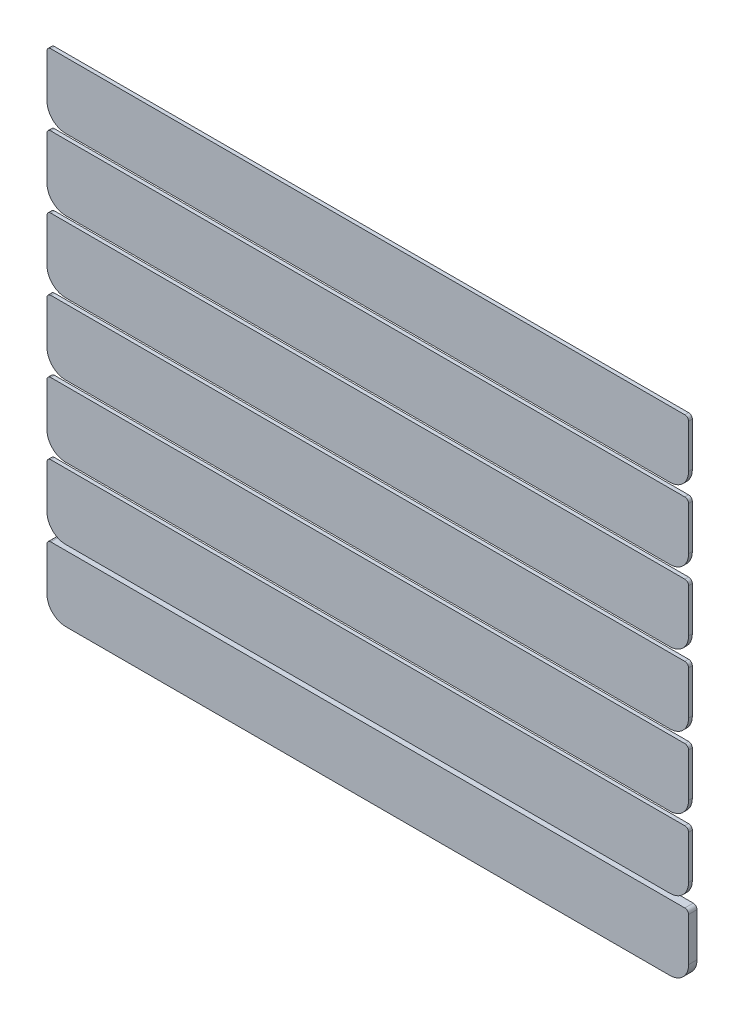
from build123d import *

# Parameters (mm, degrees)
SKETCH1_W                  = 434.975
SKETCH1_H                  = 44.704
BOSS_EXTRUDE1_DEPTH        = 3.175
FILLET1_R                  = 12.7
F_1_0_228_DIAMETER_HOLE1_D = 5.7912
FILLET2_R                  = 2.54
BOSS_EXTRUDE2_START        = 2.54
BOSS_EXTRUDE2_DEPTH        = 2.54


with BuildPart() as part:
    # Sketch1 → Boss-Extrude1 (new body)
    with BuildSketch(Plane.XY):
        Rectangle(SKETCH1_W, SKETCH1_H)
    extrude(amount=BOSS_EXTRUDE1_DEPTH)

    # Fillet1
    fillet1_edges = [part.edges().sort_by_distance(p)[0] for p in [
        (217.4875, -22.352, 1.5875),
        (-217.4875, -22.352, 1.5875),
    ]]
    fillet(fillet1_edges, radius=FILLET1_R)

    # #1 (0.228) Diameter Hole1 (through all)
    with Locations(Plane.XY.offset(3.175)):
        with Locations((166.6875, 12.7), (-166.6875, 12.7)):
            Hole(F_1_0_228_DIAMETER_HOLE1_D / 2)

    # Fillet2
    fillet2_edges = [part.edges().sort_by_distance(p)[0] for p in [
        (217.4875, 22.352, 1.5875),
        (-217.4875, 22.352, 1.5875),
    ]]
    fillet(fillet2_edges, radius=FILLET2_R)

    # Sketch4 → Boss-Extrude2 (add)
    with BuildSketch(Plane.XY.offset(3.175).offset(BOSS_EXTRUDE2_START)):
        with BuildLine():
            Line((217.4875, 38.608), (217.4875, 68.072))
            ThreePointArc((217.4875, 68.072), (216.743551224, 69.868051224), (214.9475, 70.612))
            Line((214.9475, 70.612), (-214.9475, 70.612))
            ThreePointArc((-214.9475, 70.612), (-216.743551224, 69.868051224), (-217.4875, 68.072))
            Line((-217.4875, 68.072), (-217.4875, 38.608))
            ThreePointArc((-217.4875, 38.608), (-213.767756121, 29.627743879), (-204.7875, 25.908))
            Line((-204.7875, 25.908), (204.7875, 25.908))
            ThreePointArc((204.7875, 25.908), (213.767756121, 29.627743879), (217.4875, 38.608))
        make_face()
        with BuildLine():
            Line((217.4875, -9.652), (217.4875, 19.812))
            ThreePointArc((217.4875, 19.812), (216.743551224, 21.608051224), (214.9475, 22.352))
            Line((214.9475, 22.352), (-214.9475, 22.352))
            ThreePointArc((-214.9475, 22.352), (-216.743551224, 21.608051224), (-217.4875, 19.812))
            Line((-217.4875, 19.812), (-217.4875, -9.652))
            ThreePointArc((-217.4875, -9.652), (-213.767756121, -18.632256121), (-204.7875, -22.352))
            Line((-204.7875, -22.352), (204.7875, -22.352))
            ThreePointArc((204.7875, -22.352), (213.767756121, -18.632256121), (217.4875, -9.652))
        make_face()
        with BuildLine():
            Line((217.4875, 86.868), (217.4875, 116.332))
            ThreePointArc((217.4875, 116.332), (216.743551224, 118.128051224), (214.9475, 118.872))
            Line((214.9475, 118.872), (-214.9475, 118.872))
            ThreePointArc((-214.9475, 118.872), (-216.743551224, 118.128051224), (-217.4875, 116.332))
            Line((-217.4875, 116.332), (-217.4875, 86.868))
            ThreePointArc((-217.4875, 86.868), (-213.767756121, 77.887743879), (-204.7875, 74.168))
            Line((-204.7875, 74.168), (204.7875, 74.168))
            ThreePointArc((204.7875, 74.168), (213.767756121, 77.887743879), (217.4875, 86.868))
        make_face()
        with BuildLine():
            Line((217.4875, 135.128), (217.4875, 164.592))
            ThreePointArc((217.4875, 164.592), (216.743551224, 166.388051224), (214.9475, 167.132))
            Line((214.9475, 167.132), (-214.9475, 167.132))
            ThreePointArc((-214.9475, 167.132), (-216.743551224, 166.388051224), (-217.4875, 164.592))
            Line((-217.4875, 164.592), (-217.4875, 135.128))
            ThreePointArc((-217.4875, 135.128), (-213.767756121, 126.147743879), (-204.7875, 122.428))
            Line((-204.7875, 122.428), (204.7875, 122.428))
            ThreePointArc((204.7875, 122.428), (213.767756121, 126.147743879), (217.4875, 135.128))
        make_face()
        with BuildLine():
            Line((217.4875, 183.388), (217.4875, 212.852))
            ThreePointArc((217.4875, 212.852), (216.743551224, 214.648051224), (214.9475, 215.392))
            Line((214.9475, 215.392), (-214.9475, 215.392))
            ThreePointArc((-214.9475, 215.392), (-216.743551224, 214.648051224), (-217.4875, 212.852))
            Line((-217.4875, 212.852), (-217.4875, 183.388))
            ThreePointArc((-217.4875, 183.388), (-213.767756121, 174.407743879), (-204.7875, 170.688))
            Line((-204.7875, 170.688), (204.7875, 170.688))
            ThreePointArc((204.7875, 170.688), (213.767756121, 174.407743879), (217.4875, 183.388))
        make_face()
        with BuildLine():
            Line((217.4875, 231.648), (217.4875, 261.112))
            ThreePointArc((217.4875, 261.112), (216.743551224, 262.908051224), (214.9475, 263.652))
            Line((214.9475, 263.652), (-214.9475, 263.652))
            ThreePointArc((-214.9475, 263.652), (-216.743551224, 262.908051224), (-217.4875, 261.112))
            Line((-217.4875, 261.112), (-217.4875, 231.648))
            ThreePointArc((-217.4875, 231.648), (-213.767756121, 222.667743879), (-204.7875, 218.948))
            Line((-204.7875, 218.948), (204.7875, 218.948))
            ThreePointArc((204.7875, 218.948), (213.767756121, 222.667743879), (217.4875, 231.648))
        make_face()
        with BuildLine():
            Line((217.4875, 279.908), (217.4875, 309.372))
            ThreePointArc((217.4875, 309.372), (216.743551224, 311.168051224), (214.9475, 311.912))
            Line((214.9475, 311.912), (-214.9475, 311.912))
            ThreePointArc((-214.9475, 311.912), (-216.743551224, 311.168051224), (-217.4875, 309.372))
            Line((-217.4875, 309.372), (-217.4875, 279.908))
            ThreePointArc((-217.4875, 279.908), (-213.767756121, 270.927743879), (-204.7875, 267.208))
            Line((-204.7875, 267.208), (204.7875, 267.208))
            ThreePointArc((204.7875, 267.208), (213.767756121, 270.927743879), (217.4875, 279.908))
        make_face()
    extrude(amount=-BOSS_EXTRUDE2_DEPTH)


with BuildPart() as boss_extrude2_piece_1:
    # of the separate pieces the step leaves, piece 1, a body of its own (boss_extrude2_pieces)
    add(part.part.solids().sort_by_distance((-217.4875, 19.812, 0))[0])


with BuildPart() as boss_extrude2_piece_2:
    # of the separate pieces the step leaves, piece 2, a body of its own (boss_extrude2_pieces)
    add(part.part.solids().sort_by_distance((217.4875, 135.128, 5.715))[0])


with BuildPart() as boss_extrude2_piece_3:
    # of the separate pieces the step leaves, piece 3, a body of its own (boss_extrude2_pieces)
    add(part.part.solids().sort_by_distance((217.4875, 183.388, 5.715))[0])


with BuildPart() as boss_extrude2_piece_4:
    # of the separate pieces the step leaves, piece 4, a body of its own (boss_extrude2_pieces)
    add(part.part.solids().sort_by_distance((-217.4875, 261.112, 5.715))[0])


with BuildPart() as boss_extrude2_piece_5:
    # of the separate pieces the step leaves, piece 5, a body of its own (boss_extrude2_pieces)
    add(part.part.solids().sort_by_distance((204.7875, 25.908, 5.715))[0])


with BuildPart() as boss_extrude2_piece_6:
    # of the separate pieces the step leaves, piece 6, a body of its own (boss_extrude2_pieces)
    add(part.part.solids().sort_by_distance((-204.7875, 74.168, 5.715))[0])


with BuildPart() as boss_extrude2_piece_7:
    # of the separate pieces the step leaves, piece 7, a body of its own (boss_extrude2_pieces)
    add(part.part.solids().sort_by_distance((217.4875, 279.908, 5.715))[0])


solid = Compound([boss_extrude2_piece_1.part, boss_extrude2_piece_2.part, boss_extrude2_piece_3.part, boss_extrude2_piece_4.part, boss_extrude2_piece_5.part, boss_extrude2_piece_6.part, boss_extrude2_piece_7.part])
